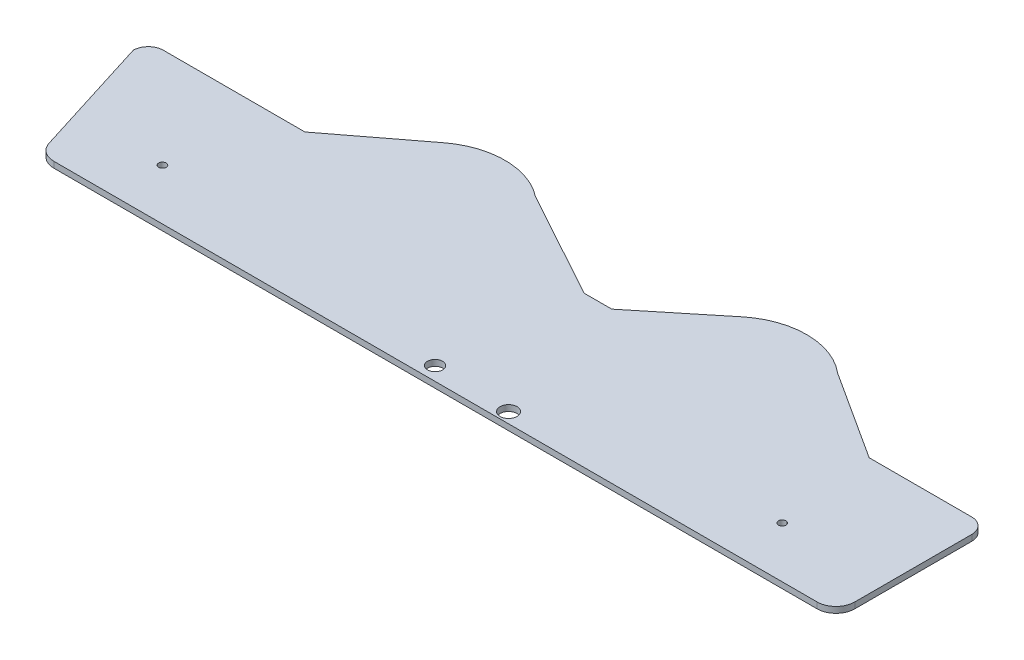
from build123d import *

# Parameters (mm, degrees)
SKETCH1_R           = 4.511205791
SKETCH1_R_2         = 4.313560469
SKETCH1_R_3         = 3.716178426
BOSS_EXTRUDE1_DEPTH = 3.175
SKETCH2_W           = 597.466303312
SKETCH2_H           = 60.972543052
CUT_EXTRUDE1_DEPTH  = 70
FILLET1_R           = 10
FILLET2_R           = 10
SKETCH3_R           = 3.990837639
CUT_EXTRUDE2_DEPTH  = 10
SKETCH4_R           = 2
CUT_EXTRUDE3_DEPTH  = 470.13785887
SKETCH5_R           = 2
CUT_EXTRUDE4_DEPTH  = 10
SKETCH6_R           = 40
BOSS_EXTRUDE2_DEPTH = 3.175
BOSS_EXTRUDE3_DEPTH = 3.175
BOSS_EXTRUDE4_DEPTH = 3.175
BOSS_EXTRUDE6_DEPTH = 3.175


with BuildPart() as part:
    # Sketch1 → Boss-Extrude1 (new body)
    with BuildSketch(Plane(origin=(0, 0, 0), x_dir=(1, 0, 0), z_dir=(0, 1, 0))):
        with BuildLine():
            ThreePointArc((8, 150), (2.343145751, 147.656854249), (0, 142))
            Line((0, 142), (42, 8))
            ThreePointArc((42, 8), (44.343145751, 2.343145751), (50, 0))
            Line((50, 0), (436.5, 0))
            ThreePointArc((436.5, 0), (442.156854249, 2.343145751), (444.5, 8))
            Line((444.5, 8), (444.5, 142))
            ThreePointArc((444.5, 142), (442.156854249, 147.656854249), (436.5, 150))
            Line((436.5, 150), (8, 150))
        make_face()
        with Locations((265.338137393, 75.633853474)):
            Circle(SKETCH1_R, mode=Mode.SUBTRACT)
        with Locations((307.606475607, 140.710564477)):
            Circle(SKETCH1_R_2, mode=Mode.SUBTRACT)
        with Locations((146.269370224, 139.84039861)):
            Circle(SKETCH1_R_3, mode=Mode.SUBTRACT)
    extrude(amount=BOSS_EXTRUDE1_DEPTH)

    # Sketch2 → Cut-Extrude1 (cut)
    with BuildSketch(Plane.XY):
        with Locations((220.1785332, 7.544358636)):
            Rectangle(SKETCH2_W, SKETCH2_H)
    extrude(amount=-CUT_EXTRUDE1_DEPTH, mode=Mode.SUBTRACT)

    # Fillet1
    fillet1_edges = [part.edges().sort_by_distance(p)[0] for p in [
        (22.567164179, 1.5875, -70),
    ]]
    fillet(fillet1_edges, radius=FILLET1_R)

    # Fillet2
    fillet2_edges = [part.edges().sort_by_distance(p)[0] for p in [
        (444.5, 1.5875, -70),
    ]]
    fillet(fillet2_edges, radius=FILLET2_R)

    # Sketch3 → Cut-Extrude2 (cut)
    with BuildSketch(Plane(origin=(0, 3.175, 0), x_dir=(1, 0, 0), z_dir=(0, 1, 0))):
        with Locations((224.75, 77.255)):
            Circle(SKETCH3_R)
    extrude(amount=-CUT_EXTRUDE2_DEPTH, mode=Mode.SUBTRACT)

    # Sketch4 → Cut-Extrude3 (cut, through all)
    with BuildSketch(Plane(origin=(0, 3.175, 0), x_dir=(1, 0, 0), z_dir=(0, 1, 0))):
        with Locations((60.5, 97)):
            Circle(SKETCH4_R)
    extrude(amount=-CUT_EXTRUDE3_DEPTH, mode=Mode.SUBTRACT)

    # Sketch5 → Cut-Extrude4 (cut)
    with BuildSketch(Plane(origin=(0, 3.175, 0), x_dir=(1, 0, 0), z_dir=(0, 1, 0))):
        with Locations((389, 97)):
            Circle(SKETCH5_R)
    extrude(amount=-CUT_EXTRUDE4_DEPTH, mode=Mode.SUBTRACT)

    # Sketch6 → Boss-Extrude2 (add)
    with BuildSketch(Plane(origin=(0, 0, 0), x_dir=(1, 0, 0), z_dir=(0, 1, 0))):
        with Locations((149, 150.04039861)):
            Circle(SKETCH6_R)
    extrude(amount=BOSS_EXTRUDE2_DEPTH)

    # Sketch7 → Boss-Extrude3 (add)
    with BuildSketch(Plane(origin=(0, 0, 0), x_dir=(1, 0, 0), z_dir=(0, 1, 0))):
        Polygon((124.164543783, 181.396420591), (82.702881078, 149.750534228), (231.468946681, 149.750534228), (173.835456217, 181.396420591), align=None)
    extrude(amount=BOSS_EXTRUDE3_DEPTH)

    # Sketch9 → Boss-Extrude4 (add)
    with BuildSketch(Plane(origin=(0, 0, 0), x_dir=(1, 0, 0), z_dir=(0, 1, 0))):
        with BuildLine():
            Line((245.673378314, 150), (269, 150))
            ThreePointArc((269, 150), (345.129166999, 132.833658165), (283.734164599, 181.010281545))
            Line((283.734164599, 181.010281545), (245.673378314, 150))
        make_face()
    extrude(amount=BOSS_EXTRUDE4_DEPTH)

    # Sketch12 → Boss-Extrude6 (add)
    with BuildSketch(Plane(origin=(0, 0, 0), x_dir=(1, 0, 0), z_dir=(0, 1, 0))):
        Polygon((326.166341835, 186.129166999), (382.106475607, 150), (340.398839744, 150), align=None)
    extrude(amount=BOSS_EXTRUDE6_DEPTH)


solid = part.part
